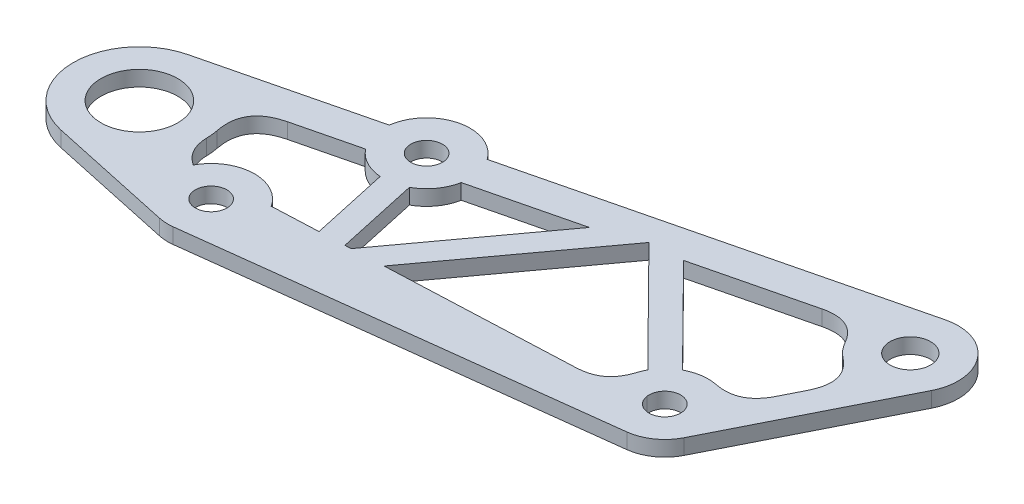
from build123d import *

# Parameters (mm, degrees)
SKETCH1_R           = 3.2639
SKETCH1_R_2         = 7.9375
SKETCH1_R_3         = 4.191
BOSS_EXTRUDE4_DEPTH = 3.175
FILLET1_START       = -3.175
FILLET1_DEPTH       = 3.175


with BuildPart() as part:
    # Sketch1 → Boss-Extrude4 (new body)
    with BuildSketch(Plane(origin=(0, 0, 0), x_dir=(1, 0, 0), z_dir=(0, 1, 0))):
        with BuildLine():
            ThreePointArc((133.726592386, 29.98785526), (132.627611185, 40.61059676), (122.521356715, 44.06226552))
            Line((122.521356715, 44.06226552), (46.442862481, 25.430137021))
            ThreePointArc((46.442862481, 25.430137021), (36.958837973, 28.991331503), (30.193743977, 21.450619984))
            Line((30.193743977, 21.450619984), (-3.247611444, 13.260609947))
            ThreePointArc((-3.247611444, 13.260609947), (-13.651169136, -0.190623903), (-2.876077052, -13.346120674))
            Line((-2.876077052, -13.346120674), (23.107180797, -18.945489468))
            ThreePointArc((23.107180797, -18.945489468), (24.589406384, -19.137653713), (26.082973185, -19.081279984))
            Line((26.082973185, -19.081279984), (109.669270086, -8.913192671))
            ThreePointArc((109.669270086, -8.913192671), (113.749462268, -7.344996575), (116.60566957, -4.036025875))
            Line((116.60566957, -4.036025875), (133.726592386, 29.98785526))
        make_face()
        with Locations(Location((24.998703099, -10.168087313, 0), (0, 0, 270))):
            Circle(SKETCH1_R, mode=Mode.SUBTRACT)
        with Locations(Location((0, 0, 0), (0, 0, 270))):
            Circle(SKETCH1_R_2, mode=Mode.SUBTRACT)
        with BuildLine():
            Line((38.450716367, 11.314391845), (41.984168993, -4.864970405))
            Line((41.984168993, -4.864970405), (32.525550861, -5.272455792))
            ThreePointArc((32.525550861, -5.272455792), (24.612242842, -1.197507974), (17.07870805, -5.937919038))
            Line((17.07870805, -5.937919038), (12.189591197, -6.148546389))
            ThreePointArc((12.189591197, -6.148546389), (13.515826194, 1.926966151), (9.985636063, 9.310092839))
            Line((9.985636063, 9.310092839), (32.042893317, 14.712061629))
            ThreePointArc((32.042893317, 14.712061629), (34.888474765, 12.337435423), (38.450716367, 11.314391845))
        make_face(mode=Mode.SUBTRACT)
        with Locations(Location((39.094708942, 20.270167566, 0), (0, 0, 270))):
            Circle(SKETCH1_R, mode=Mode.SUBTRACT)
        with BuildLine():
            Line((54.876229285, -4.309569382), (78.030840873, 27.282347644))
            Line((78.030840873, 27.282347644), (100.723144875, 4.337266328))
            ThreePointArc((100.723144875, 4.337266328), (99.66914772, 1.062178575), (99.924218758, -2.368863331))
            Line((99.924218758, -2.368863331), (54.876229285, -4.309569382))
        make_face(mode=Mode.SUBTRACT)
        with BuildLine():
            Line((104.335087932, 7.90941797), (84.823475635, 27.638376771))
            Line((84.823475635, 27.638376771), (114.98908268, 35.026134276))
            ThreePointArc((114.98908268, 35.026134276), (117.570132445, 27.752761279), (124.58688197, 24.538885311))
            Line((124.58688197, 24.538885311), (115.260501822, 6.004858086))
            ThreePointArc((115.260501822, 6.004858086), (110.126982004, 8.845503757), (104.335087932, 7.90941797))
        make_face(mode=Mode.SUBTRACT)
        with Locations(Location((108.585, 0, 0), (0, 0, 270))):
            Circle(SKETCH1_R, mode=Mode.SUBTRACT)
        with BuildLine():
            Line((47.13543811, -4.64304931), (43.413738486, 12.398279038))
            ThreePointArc((43.413738486, 12.398279038), (46.36017499, 14.994407118), (47.916850432, 18.599699151))
            Line((47.916850432, 18.599699151), (69.18664036, 23.808811963))
            Line((69.18664036, 23.808811963), (48.372525925, -4.589754505))
            Line((48.372525925, -4.589754505), (47.13543811, -4.64304931))
        make_face(mode=Mode.SUBTRACT)
        with Locations(Location((124.877763158, 34.440613651, 0), (0, 0, 270))):
            Circle(SKETCH1_R_3, mode=Mode.SUBTRACT)
    extrude(amount=-BOSS_EXTRUDE4_DEPTH)

    # Fillet1: read off the stored shape, not the designer's step
    # Fillet1 outline → Fillet1 (add)
    with BuildSketch(Plane(origin=(0, 0, 0), x_dir=(1, 0, 0), z_dir=(0, 1, 0)).offset(FILLET1_START)):
        with BuildLine():
            Line((114.98908268, 35.026134276), (107.783269008, 33.261382651))
            add(Edge.make_bspline(
                [(107.783269008, 33.261382651), (113.406008329, 34.638428853), (116.240182309, 29.590764883)],
                knots=[0, 0, 0, 1, 1, 1], degree=2))
            ThreePointArc((116.240182309, 29.590764883), (115.224193881, 32.218579403), (114.98908268, 35.026134276))
        make_face()
        with BuildLine():
            Line((115.260501822, 6.004858086), (118.700286007, 12.840634961))
            add(Edge.make_bspline(
                [(118.700286007, 12.840634961), (116.082209563, 7.637812501), (110.374675184, 8.798733315)],
                knots=[0, 0, 0, 1, 1, 1], degree=2))
            ThreePointArc((110.374675184, 8.798733315), (113.042156059, 7.794511215), (115.260501822, 6.004858086))
        make_face()
        with BuildLine():
            ThreePointArc((124.58688197, 24.538885311), (121.515947768, 25.122511201), (118.779768978, 26.633994475))
            add(Edge.make_bspline(
                [(118.779768978, 26.633994475), (123.70514236, 22.786631417), (120.895795937, 17.203704037)],
                knots=[0, 0, 0, 1, 1, 1], degree=2))
            Line((120.895795937, 17.203704037), (124.58688197, 24.538885311))
        make_face()
        with BuildLine():
            ThreePointArc((9.985636063, 9.310092839), (12.154183418, 6.21824587), (13.392725611, 2.650595587))
            add(Edge.make_bspline(
                [(13.392725611, 2.650595587), (11.978146555, 9.798071891), (19.055114913, 11.531268442)],
                knots=[0, 0, 0, 1, 1, 1], degree=2))
            Line((19.055114913, 11.531268442), (9.985636063, 9.310092839))
        make_face()
        with BuildLine():
            add(Edge.make_bspline(
                [(17.07870805, -5.937919038), (13.730219916, -3.733889963), (13.649749039, 0.274057316)],
                knots=[0, 0, 0, 1, 1, 1], degree=2))
            ThreePointArc((13.649749039, 0.274057316), (13.312788421, -3.026618691), (12.189591197, -6.148546389))
            Line((12.189591197, -6.148546389), (17.07870805, -5.937919038))
        make_face()
        with BuildLine():
            ThreePointArc((99.924218758, -2.368863331), (99.607534733, 0.160507278), (100.014432232, 2.67694104))
            add(Edge.make_bspline(
                [(100.014432232, 2.67694104), (98.418154374, -2.433745878), (93.068937879, -2.664194715)],
                knots=[0, 0, 0, 1, 1, 1], degree=2))
            Line((93.068937879, -2.664194715), (99.924218758, -2.368863331))
        make_face()
    extrude(amount=FILLET1_DEPTH)


solid = part.part
